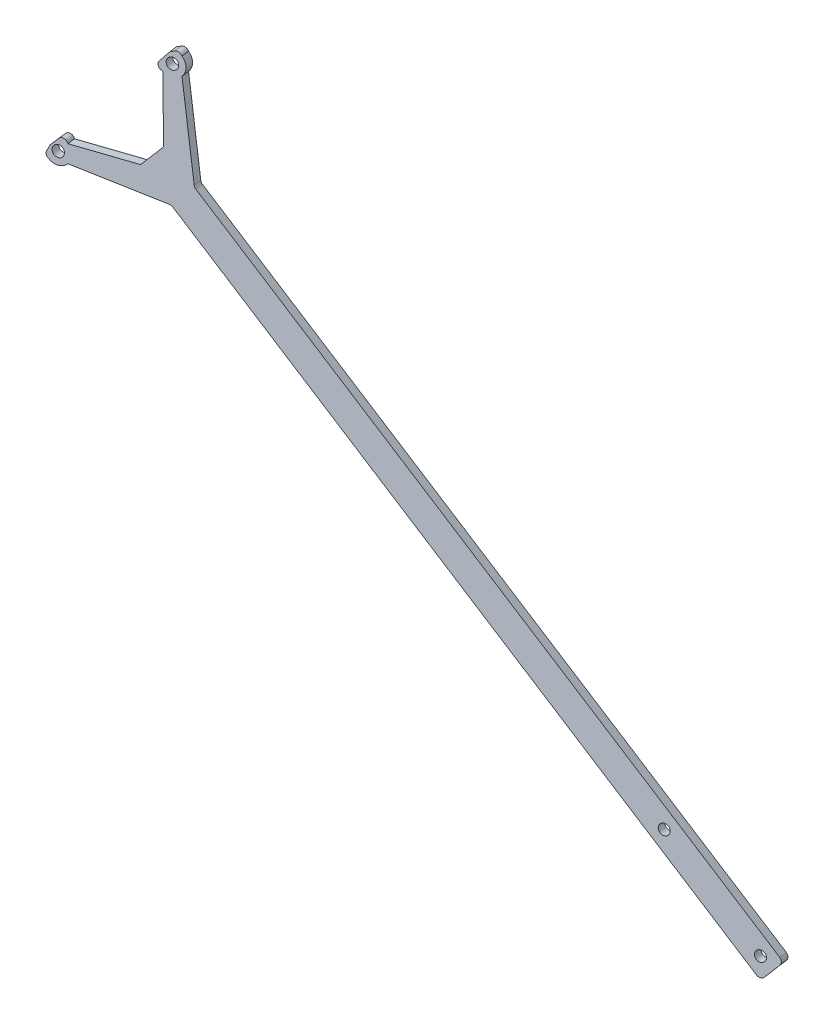
from build123d import *

# Parameters (mm, degrees)
SZKIC3_R                    = 1.10000034
DODANIE_WYCI_GNI_CIE2_DEPTH = 2
SZKIC7_R                    = 1.15000024
DODANIE_WYCI_GNI_CIE4_DEPTH = 2
ZAOKR_GLENIE1_R             = 1


with BuildPart() as part:
    # Szkic3 → Dodanie-wyciągnięcie2 (new body)
    with BuildSketch(Plane(origin=(38.160641903, 20.207828477, 157.30929901), x_dir=(0.972253346903095, -0.029805597670841302, -0.23202382589556209), z_dir=(0.23393039442477367, 0.12387698555880203, 0.964329333274237))):
        Polygon((-69.666310572, -102.553561212), (-79.264860968, -94.782442078), (-80.819178513, -93.5240451), (-77.043735552, -88.860781173), (-75.489418007, -90.119178151), (-65.890867611, -97.890297285), (-52.950125678, -108.367300905), (-56.725568639, -113.030564831), align=None)
        with Locations(Location((-57.169345947, -108.811046896, 0), (0, 0, 1.721249632))):
            Circle(SZKIC3_R, mode=Mode.SUBTRACT)
        with Locations(Location((-76.599691895, -93.079970126, 0), (0, 0, 1.721249632))):
            Circle(SZKIC3_R, mode=Mode.SUBTRACT)
    extrude(amount=DODANIE_WYCI_GNI_CIE2_DEPTH)

    # Szkic7 → Dodanie-wyciągnięcie4 (add)
    with BuildSketch(Plane(origin=(38.628502692, 20.455582448, 159.237957676), x_dir=(0.9722533469030947, -0.029805597670841396, -0.23202382589556286), z_dir=(0.23393039442477445, 0.12387698555880199, 0.9643293332742368))):
        with BuildLine():
            Line((-80.819178513, -93.5240451), (-175.638878356, -16.756704897))
            Line((-175.638878356, -16.756704897), (-194.757445315, -16.460528815))
            ThreePointArc((-194.757445315, -16.460528815), (-196.438982344, -17.373715152), (-198.273708049, -16.830338985))
            Line((-198.273708049, -16.830338985), (-199.491256389, -17.388602921))
            Line((-199.491256389, -17.388602921), (-198.273726955, -14.349785721))
            Line((-198.273726955, -14.349785721), (-195.616721108, -11.132918291))
            Line((-195.616721108, -11.132918291), (-195.127524487, -12.944294382))
            Line((-195.127524487, -12.944294382), (-181.856563591, -11.72278095))
            Line((-181.856563591, -11.72278095), (-178.08112063, -7.059517023))
            Line((-178.08112063, -7.059517023), (-179.648209308, 6.175086532))
            Line((-179.648209308, 6.175086532), (-181.521733094, 6.276601555))
            Line((-181.521733094, 6.276601555), (-178.718962553, 10.061139804))
            Line((-178.718962553, 10.061139804), (-176.20935813, 11.368191294))
            Line((-176.20935813, 11.368191294), (-176.502006841, 10.061139804))
            ThreePointArc((-176.502006841, 10.061139804), (-175.588684843, 8.379653584), (-176.131934764, 6.544869536))
            Line((-176.131934764, 6.544869536), (-171.863435395, -12.093440971))
            Line((-171.863435395, -12.093440971), (-77.043735552, -88.860781173))
            Line((-77.043735552, -88.860781173), (-80.819178513, -93.5240451))
        make_face()
        with Locations(Location((-178.074960694, 8.117983918, 0), (0, 0, 1.721249632))):
            Circle(SZKIC7_R, mode=Mode.SUBTRACT)
        with Locations(Location((-196.700467622, -14.887437029, 0), (0, 0, 1.721249632))):
            Circle(SZKIC7_R, mode=Mode.SUBTRACT)
    extrude(amount=-DODANIE_WYCI_GNI_CIE4_DEPTH)

    # Zaokrąglenie1
    # the kernel refuses this fillet: 1 mm, written as the material it adds along each edge
    with BuildSketch(Plane(origin=(-132.136984635, 9.070469004, 202.125371666), x_dir=(0.7556456600365923, -0.6472773151749931, -0.10015844311747091), z_dir=(-0.23393039442477445, -0.12387698555880199, -0.9643293332742368))) as zaokr_glenie1_piece_1:
        with BuildLine():
            CenterArc((ZAOKR_GLENIE1_R * 0.345368312497, ZAOKR_GLENIE1_R), ZAOKR_GLENIE1_R, 231.893419256, 38.106580745)
            Line((-ZAOKR_GLENIE1_R * 0.271757942514, ZAOKR_GLENIE1_R * 0.213135853291), (0, 0))
            Line((0, 0), (ZAOKR_GLENIE1_R * 0.345368312498, 0))
        make_face()
    extrude(amount=2)
    with BuildSketch(Plane(origin=(-128.466297581, 13.583197282, 200.655222001), x_dir=(0.755645659983129, -0.6472773152407205, -0.10015844309605833), z_dir=(-0.23393039442477445, -0.12387698555880199, -0.9643293332742368))) as zaokr_glenie1_piece_2:
        with BuildLine():
            CenterArc((ZAOKR_GLENIE1_R * 0.345368517806, -ZAOKR_GLENIE1_R), ZAOKR_GLENIE1_R, 89.999999995, 38.106601769)
            Line((-ZAOKR_GLENIE1_R * 0.271758025873, -ZAOKR_GLENIE1_R * 0.213136079689), (0, 0))
            Line((0, 0), (ZAOKR_GLENIE1_R * 0.345368517893, 0))
        make_face()
    extrude(amount=2)
    # the kernel refuses this fillet: 1 mm, written as the material it takes off along each edge
    with BuildSketch(Plane(origin=(-150.430265808, 15.842388646, 210.703360527), x_dir=(-0.6191538304813691, -0.7457448210428924, 0.24599430092575822), z_dir=(-0.23393039442477445, -0.12387698555880199, -0.9643293332742368))) as zaokr_glenie1_2_piece_1:
        with BuildLine():
            CenterArc((1.932614717, -1), ZAOKR_GLENIE1_R, 90, 122.052914314)
            Line((1.085056378, -1.530702235), (0, 0))
            Line((0, 0), (1.932614717, 0))
        make_face()
    extrude(amount=11.663073583, mode=Mode.SUBTRACT)
    with BuildSketch(Plane(origin=(-154.176575818, 9.764143782, 212.484809281), x_dir=(0.8837805609022797, 0.3863007559342876, -0.2640144809207439), z_dir=(-0.23393039442477445, -0.12387698555880199, -0.9643293332742368))) as zaokr_glenie1_2_piece_2:
        with BuildLine():
            CenterArc((2.115550514, -0.630589135), ZAOKR_GLENIE1_R, 140.906398732, 85.559709417)
            Line((1.426766982, -1.355556201), (0, 0))
            Line((0, 0), (1.339433679, 0))
        make_face()
    extrude(amount=11.840219302, mode=Mode.SUBTRACT)
    with BuildSketch(Plane(origin=(-136.76997961, 32.666813554, 205.035015593), x_dir=(0.9708292594479915, -0.08342561993848581, -0.22479037999332602), z_dir=(-0.23393039442477445, -0.12387698555880199, -0.9643293332742368))) as zaokr_glenie1_2_piece_3:
        with BuildLine():
            CenterArc((ZAOKR_GLENIE1_R * 1.85804027171, -ZAOKR_GLENIE1_R), ZAOKR_GLENIE1_R, 90, 123.421594356)
            Line((ZAOKR_GLENIE1_R * 1.02339993985, -ZAOKR_GLENIE1_R * 1.55079534897), (0, 0))
            Line((0, 0), (ZAOKR_GLENIE1_R * 1.85804027171, 0))
        make_face()
    extrude(amount=11.290201359, mode=Mode.SUBTRACT)
    with BuildSketch(Plane(origin=(-131.602089653, 37.560111501, 203.16570616), x_dir=(-0.8623099936693889, -0.4317250154405725, 0.26464123990930793), z_dir=(-0.23393039442477445, -0.12387698555880199, -0.9643293332742368))) as zaokr_glenie1_2_piece_4:
        with BuildLine():
            CenterArc((1.863025718, -1), ZAOKR_GLENIE1_R, 90, 91.379076601)
            Line((0.863315373, -1.024067103), (0, 0))
            Line((0, 0), (1.863025718, 0))
        make_face()
    extrude(amount=11.315128591, mode=Mode.SUBTRACT)
    with BuildSketch(Plane(origin=(-13.905120992, -86.007744656, 180.991487948), x_dir=(-0.6117811757755813, -0.7521213796372446, 0.24502494415715118), z_dir=(0.23393039442477367, 0.12387698555880203, 0.964329333274237)), Plane(origin=(-17.575808047, -90.520472934, 182.461637613), x_dir=(-0.7556456600354768, 0.6472773151763643, 0.10015844311702354), z_dir=(0.23393039442477367, 0.12387698555880203, 0.964329333274237))) as zaokr_glenie1_2_piece_5:
        with BuildLine():
            CenterArc((ZAOKR_GLENIE1_R, -ZAOKR_GLENIE1_R), ZAOKR_GLENIE1_R, 90, 90)
            Line((0, -ZAOKR_GLENIE1_R), (0, 0))
            Line((0, 0), (ZAOKR_GLENIE1_R, 0))
        make_face()
    extrude(amount=7, mode=Mode.SUBTRACT)


solid = part.part
